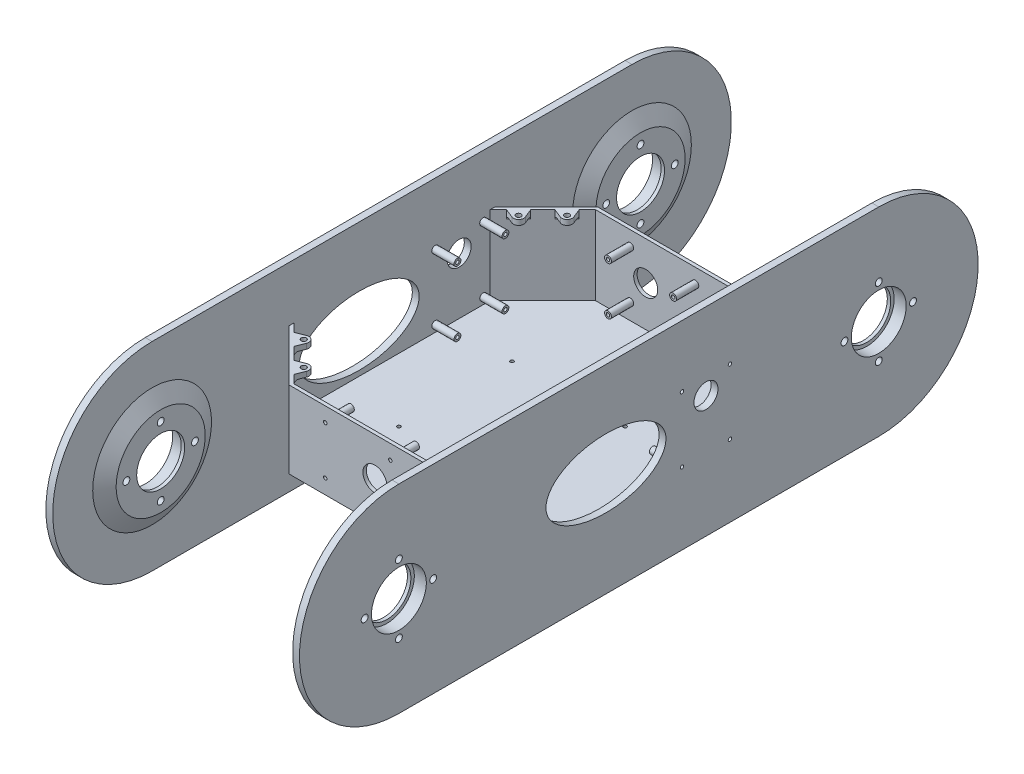
from build123d import *

# Parameters (mm, degrees)
SKETCH1_W           = 140
SKETCH1_H           = 180
BOSS_EXTRUDE1_DEPTH = 52
CHAMFER1_SIZE       = 30
BOSS_EXTRUDE2_DEPTH = 4
SKETCH3_R           = 26
BOSS_EXTRUDE3_DEPTH = 5
BOSS_EXTRUDE3_DRAFT = 60
SKETCH4_R           = 14
CUT_EXTRUDE1_DEPTH  = 2
SKETCH5_R           = 16
CUT_EXTRUDE2_DEPTH  = 256.007843017
MIRROR1_OUTLINE_W   = 16
MIRROR1_OUTLINE_H   = 4
SKETCH6_R           = 2
CUT_EXTRUDE3_DEPTH  = 257.087875543
CUT_EXTRUDE4_DEPTH  = 46
SKETCH8_R           = 1
SKETCH8_R_2         = 7
SKETCH8_RX          = 35
SKETCH8_RY          = 20
CUT_EXTRUDE5_DEPTH  = 262.082362484
CHAMFER3_SIZE       = 7
SKETCH9_R           = 1
CUT_EXTRUDE6_DEPTH  = 226.308677307
SKETCH10_R          = 1
CUT_EXTRUDE7_DEPTH  = 309.991909424
SKETCH11_R          = 2
SKETCH11_R_2        = 1
BOSS_EXTRUDE4_DEPTH = 13
SKETCH12_R          = 2
SKETCH12_R_2        = 1
BOSS_EXTRUDE5_DEPTH = 13
SKETCH13_R          = 7
CUT_EXTRUDE8_DEPTH  = 3
SKETCH14_R          = 7
CUT_EXTRUDE9_DEPTH  = 3
SKETCH15_R          = 1.5
BOSS_EXTRUDE6_DEPTH = 3
FILLET1_R           = 2


# Read off the part's stored shape, not the designer's step: Mirror1, Mirror2
with BuildPart() as part:
    # Sketch1 → Boss-Extrude1 (new body)
    with BuildSketch(Plane(origin=(0, 0, 0), x_dir=(1, 0, 0), z_dir=(0, 1, 0))):
        Rectangle(SKETCH1_W, SKETCH1_H)
    extrude(amount=BOSS_EXTRUDE1_DEPTH)

    # Chamfer1
    chamfer1_edges = [part.edges().sort_by_distance(p)[0] for p in [
        (-70, 26, 90),
        (70, 26, 90),
        (70, 26, -90),
        (-70, 26, -90),
    ]]
    chamfer(chamfer1_edges, length=CHAMFER1_SIZE)

    # Sketch2 → Boss-Extrude2 (add)
    with BuildSketch(Plane(origin=(70, 0, 0), x_dir=(0, 0, -1), z_dir=(1, 0, 0))):
        with BuildLine():
            Line((-140, 84), (140, 84))
            ThreePointArc((140, 84), (198, 26), (140, -32))
            Line((140, -32), (-140, -32))
            ThreePointArc((-140, -32), (-198, 26), (-140, 84))
        make_face()
    extrude(amount=BOSS_EXTRUDE2_DEPTH)


with BuildPart() as boss_extrude3_tool:
    # Sketch3 → Boss-Extrude3 (with draft: the straight prism first)
    with BuildSketch(Plane.ZY.offset(-65)):
        with Locations((140, 26)):
            Circle(SKETCH3_R)
    extrude(amount=-BOSS_EXTRUDE3_DEPTH)
    # Boss-Extrude3: the draft: its side faces are tilted about the plane it starts from
    boss_extrude3_sides = [boss_extrude3_tool.faces().sort_by_distance(p)[0] for p in [
        (67.5, 26, 114),
    ]]
    draft(boss_extrude3_sides, Plane.ZY.offset(-65), BOSS_EXTRUDE3_DRAFT)


with BuildPart() as part_1:
    add(part.part)

    # Boss-Extrude3: add boss_extrude3_tool
    add(boss_extrude3_tool.part)

    # Sketch4 → Cut-Extrude1 (cut)
    with BuildSketch(Plane.ZY.offset(-65)):
        with Locations((140, 26)):
            Circle(SKETCH4_R)
    extrude(amount=-CUT_EXTRUDE1_DEPTH, mode=Mode.SUBTRACT)

    # Sketch5 → Cut-Extrude2 (cut, through all)
    with BuildSketch(Plane.ZY.offset(-67)):
        with Locations((140, 26)):
            Circle(SKETCH5_R)
    extrude(amount=-CUT_EXTRUDE2_DEPTH, mode=Mode.SUBTRACT)

    # Mirror1 outline → Mirror1 (revolve, cut)
    with BuildSketch(Plane(origin=(0, 26, -140), x_dir=(0, 1, 0), z_dir=(0, 0, -1))):
        with Locations((8, 72)):
            Rectangle(MIRROR1_OUTLINE_W, MIRROR1_OUTLINE_H)
    revolve(axis=Axis((0, 26, -140), (1, 0, 0)), mode=Mode.SUBTRACT)

    # Mirror1 2 outline → Mirror1 2 (revolve)
    with BuildSketch(Plane(origin=(0, 26, -140), x_dir=(0, 1, 0), z_dir=(0, 0, -1))):
        Polygon((14, 67), (14, 65), (26, 65), (34.660254038, 70), (16, 70), (16, 67), align=None)
    revolve(axis=Axis((0, 26, -140), (1, 0, 0)))

    # Mirror2: part across plane


with BuildPart() as part_2:
    add(part_1.part)
    add(part_1.part.mirror(Plane(origin=(0, 0, 0), x_dir=(0, 0, 1), z_dir=(1, 0, 0))))

    # Sketch6 → Cut-Extrude3 (cut, symmetric)
    with BuildSketch(Plane(origin=(-65, 0, 0), x_dir=(0, 0, -1), z_dir=(1, 0, 0))):
        with Locations((-140, 46)):
            Circle(SKETCH6_R)
        with Locations((-120, 26)):
            Circle(SKETCH6_R)
        with Locations((-140, 6)):
            Circle(SKETCH6_R)
        with Locations((-160, 26)):
            Circle(SKETCH6_R)
    cut_extrude3 = extrude(amount=CUT_EXTRUDE3_DEPTH, both=True, mode=Mode.SUBTRACT)

    # Mirror3: Cut-Extrude3 across plane
    add(cut_extrude3.mirror(Plane.XY), mode=Mode.SUBTRACT)

    # Sketch7 → Cut-Extrude4 (cut)
    with BuildSketch(Plane(origin=(0, 52, 0), x_dir=(1, 0, 0), z_dir=(0, 1, 0))):
        Polygon((-70, 57.171572875), (-39.171572875, 88), (39.171572875, 88), (70, 57.171572875), (70, -57.171572875), (39.171572875, -88), (-39.171572875, -88), (-70, -57.171572875), align=None)
    extrude(amount=-CUT_EXTRUDE4_DEPTH, mode=Mode.SUBTRACT)

    # Sketch8 → Cut-Extrude5 (cut, through all)
    with BuildSketch(Plane(origin=(74, 0, 0), x_dir=(0, 0, -1), z_dir=(1, 0, 0))):
        with Locations((25.171572875, 48)):
            Circle(SKETCH8_R)
        with Locations((53.171572875, 48)):
            Circle(SKETCH8_R)
        with Locations((53.171572875, 10)):
            Circle(SKETCH8_R)
        with Locations((25.171572875, 10)):
            Circle(SKETCH8_R)
        with Locations((39.171572875, 39)):
            Circle(SKETCH8_R_2)
        with Locations(Location((-19.171572875, 29), (0, 0, -180))):
            Ellipse(SKETCH8_RX, SKETCH8_RY)
    extrude(amount=-CUT_EXTRUDE5_DEPTH, mode=Mode.SUBTRACT)

    # Chamfer3
    chamfer3_edges = [part_2.edges().sort_by_distance(p)[0] for p in [
        (0, 0, -90),
        (0, 0, 90),
        (55, 0, 75),
        (-55, 0, 75),
        (55, 0, -75),
        (-55, 0, -75),
    ]]
    chamfer(chamfer3_edges, length=CHAMFER3_SIZE)

    # Sketch9 → Cut-Extrude6 (cut, through all)
    with BuildSketch(Plane(origin=(0, 6, 0), x_dir=(1, 0, 0), z_dir=(0, 1, 0))):
        with Locations(Location((-33, 33, 0), (0, 0, 270))):
            Circle(SKETCH9_R)
        with Locations(Location((33, 33, 0), (0, 0, 270))):
            Circle(SKETCH9_R)
        with Locations(Location((33, -33, 0), (0, 0, 270))):
            Circle(SKETCH9_R)
        with Locations(Location((-33, -33, 0), (0, 0, 270))):
            Circle(SKETCH9_R)
    extrude(amount=-CUT_EXTRUDE6_DEPTH, mode=Mode.SUBTRACT)

    # Sketch10 → Cut-Extrude7 (cut, through all)
    with BuildSketch(Plane(origin=(0, 0, -90), x_dir=(-1, 0, 0), z_dir=(0, 0, -1))):
        with Locations((-19, 43.5)):
            Circle(SKETCH10_R)
        with Locations((19, 43.5)):
            Circle(SKETCH10_R)
        with Locations((19, 15.5)):
            Circle(SKETCH10_R)
        with Locations((-19, 15.5)):
            Circle(SKETCH10_R)
    extrude(amount=-CUT_EXTRUDE7_DEPTH, mode=Mode.SUBTRACT)

    # Sketch11 → Boss-Extrude4 (add)
    # profile 1 of 4: a face of its own
    with BuildSketch(Plane.ZY.offset(-70)):
        with Locations(Location((-53.171572875, 48, 0), (0, 0, 180))):
            Circle(SKETCH11_R)
        with Locations(Location((-53.171572875, 48, 0), (0, 0, 180))):
            Circle(SKETCH11_R_2, mode=Mode.SUBTRACT)
    # profile 2 of 4: a face of its own
    with BuildSketch(Plane.ZY.offset(-70)):
        with Locations(Location((-25.171572875, 48, 0), (0, 0, 180))):
            Circle(SKETCH11_R)
        with Locations(Location((-25.171572875, 48, 0), (0, 0, 180))):
            Circle(SKETCH11_R_2, mode=Mode.SUBTRACT)
    # profile 3 of 4: a face of its own
    with BuildSketch(Plane.ZY.offset(-70)):
        with Locations(Location((-25.171572875, 10, 0), (0, 0, 180))):
            Circle(SKETCH11_R)
        with Locations(Location((-25.171572875, 10, 0), (0, 0, 180))):
            Circle(SKETCH11_R_2, mode=Mode.SUBTRACT)
    # profile 4 of 4: a face of its own
    with BuildSketch(Plane.ZY.offset(-70)):
        with Locations(Location((-53.171572875, 10, 0), (0, 0, 180))):
            Circle(SKETCH11_R)
        with Locations(Location((-53.171572875, 10, 0), (0, 0, 180))):
            Circle(SKETCH11_R_2, mode=Mode.SUBTRACT)
    boss_extrude4 = extrude(amount=BOSS_EXTRUDE4_DEPTH)

    # Mirror4: Boss-Extrude4 across plane
    add(boss_extrude4.mirror(Plane(origin=(0, 0, 0), x_dir=(0, 0, 1), z_dir=(1, 0, 0))))

    # Sketch12 → Boss-Extrude5 (add)
    # profile 1 of 4: a face of its own
    with BuildSketch(Plane.XY.offset(-88)):
        with Locations(Location((-19, 43.5, 0), (0, 0, 180))):
            Circle(SKETCH12_R)
        with Locations(Location((-19, 43.5, 0), (0, 0, 180))):
            Circle(SKETCH12_R_2, mode=Mode.SUBTRACT)
    # profile 2 of 4: a face of its own
    with BuildSketch(Plane.XY.offset(-88)):
        with Locations(Location((19, 43.5, 0), (0, 0, 180))):
            Circle(SKETCH12_R)
        with Locations(Location((19, 43.5, 0), (0, 0, 180))):
            Circle(SKETCH12_R_2, mode=Mode.SUBTRACT)
    # profile 3 of 4: a face of its own
    with BuildSketch(Plane.XY.offset(-88)):
        with Locations(Location((19, 15.5, 0), (0, 0, 180))):
            Circle(SKETCH12_R)
        with Locations(Location((19, 15.5, 0), (0, 0, 180))):
            Circle(SKETCH12_R_2, mode=Mode.SUBTRACT)
    # profile 4 of 4: a face of its own
    with BuildSketch(Plane.XY.offset(-88)):
        with Locations(Location((-19, 15.5, 0), (0, 0, 180))):
            Circle(SKETCH12_R)
        with Locations(Location((-19, 15.5, 0), (0, 0, 180))):
            Circle(SKETCH12_R_2, mode=Mode.SUBTRACT)
    boss_extrude5 = extrude(amount=BOSS_EXTRUDE5_DEPTH)

    # Mirror5: Boss-Extrude5 across plane
    add(boss_extrude5.mirror(Plane.XY))

    # Sketch13 → Cut-Extrude8 (cut)
    with BuildSketch(Plane.XY.offset(90)):
        with Locations((10, 29.5)):
            Circle(SKETCH13_R)
    extrude(amount=-CUT_EXTRUDE8_DEPTH, mode=Mode.SUBTRACT)

    # Sketch14 → Cut-Extrude9 (cut)
    with BuildSketch(Plane(origin=(0, 0, -90), x_dir=(-1, 0, 0), z_dir=(0, 0, -1))):
        with Locations((10, 29.5)):
            Circle(SKETCH14_R)
    extrude(amount=-CUT_EXTRUDE9_DEPTH, mode=Mode.SUBTRACT)

    # Sketch15 → Boss-Extrude6 (add)
    # profile 1 of 8: a face of its own
    with BuildSketch(Plane(origin=(0, 52, 0), x_dir=(1, 0, 0), z_dir=(0, 1, 0))):
        with BuildLine():
            Line((-65.192388155, 61.97918472), (-59.932711253, 59.896926598))
            ThreePointArc((-59.932711253, 59.896926598), (-56.707106781, 60.564971157), (-56.039062222, 63.79057563))
            Line((-56.039062222, 63.79057563), (-58.121320344, 69.050252532))
            Line((-58.121320344, 69.050252532), (-65.192388155, 61.97918472))
        make_face()
        with Locations(Location((-58.828427125, 62.686291501, 0), (0, 0, 270))):
            Circle(SKETCH15_R, mode=Mode.SUBTRACT)
    # profile 2 of 8: a face of its own
    with BuildSketch(Plane(origin=(0, 52, 0), x_dir=(1, 0, 0), z_dir=(0, 1, 0))):
        with BuildLine():
            Line((-43.97918472, 83.192388155), (-41.896926598, 77.932711253))
            ThreePointArc((-41.896926598, 77.932711253), (-42.564971157, 74.707106781), (-45.79057563, 74.039062222))
            Line((-45.79057563, 74.039062222), (-51.050252532, 76.121320344))
            Line((-51.050252532, 76.121320344), (-43.97918472, 83.192388155))
        make_face()
        with Locations(Location((-44.686291501, 76.828427125, 0), (0, 0, 90))):
            Circle(SKETCH15_R, mode=Mode.SUBTRACT)
    # profile 3 of 8: a face of its own
    with BuildSketch(Plane(origin=(0, 52, 0), x_dir=(1, 0, 0), z_dir=(0, 1, 0))):
        with BuildLine():
            Line((51.050252532, 76.121320344), (43.97918472, 83.192388155))
            Line((43.97918472, 83.192388155), (41.896926598, 77.932711253))
            ThreePointArc((41.896926598, 77.932711253), (42.564971157, 74.707106781), (45.79057563, 74.039062222))
            Line((45.79057563, 74.039062222), (51.050252532, 76.121320344))
        make_face()
        with Locations(Location((44.686291501, 76.828427125, 0), (0, 0, 270))):
            Circle(SKETCH15_R, mode=Mode.SUBTRACT)
    # profile 4 of 8: a face of its own
    with BuildSketch(Plane(origin=(0, 52, 0), x_dir=(1, 0, 0), z_dir=(0, 1, 0))):
        with BuildLine():
            Line((65.192388155, 61.97918472), (59.932711253, 59.896926598))
            ThreePointArc((59.932711253, 59.896926598), (56.707106781, 60.564971157), (56.039062222, 63.79057563))
            Line((56.039062222, 63.79057563), (58.121320344, 69.050252532))
            Line((58.121320344, 69.050252532), (65.192388155, 61.97918472))
        make_face()
        with Locations(Location((58.828427125, 62.686291501, 0), (0, 0, 90))):
            Circle(SKETCH15_R, mode=Mode.SUBTRACT)
    # profile 5 of 8: a face of its own
    with BuildSketch(Plane(origin=(0, 52, 0), x_dir=(1, 0, 0), z_dir=(0, 1, 0))):
        with BuildLine():
            Line((65.192388155, -61.97918472), (58.121320344, -69.050252532))
            Line((58.121320344, -69.050252532), (56.039062222, -63.79057563))
            ThreePointArc((56.039062222, -63.79057563), (56.707106781, -60.564971157), (59.932711253, -59.896926598))
            Line((59.932711253, -59.896926598), (65.192388155, -61.97918472))
        make_face()
        with Locations(Location((58.828427125, -62.686291501, 0), (0, 0, 270))):
            Circle(SKETCH15_R, mode=Mode.SUBTRACT)
    # profile 6 of 8: a face of its own
    with BuildSketch(Plane(origin=(0, 52, 0), x_dir=(1, 0, 0), z_dir=(0, 1, 0))):
        with BuildLine():
            Line((51.050252532, -76.121320344), (45.79057563, -74.039062222))
            ThreePointArc((45.79057563, -74.039062222), (42.564971157, -74.707106781), (41.896926598, -77.932711253))
            Line((41.896926598, -77.932711253), (43.97918472, -83.192388155))
            Line((43.97918472, -83.192388155), (51.050252532, -76.121320344))
        make_face()
        with Locations(Location((44.686291501, -76.828427125, 0), (0, 0, 90))):
            Circle(SKETCH15_R, mode=Mode.SUBTRACT)
    # profile 7 of 8: a face of its own
    with BuildSketch(Plane(origin=(0, 52, 0), x_dir=(1, 0, 0), z_dir=(0, 1, 0))):
        with BuildLine():
            Line((-51.050252532, -76.121320344), (-43.97918472, -83.192388155))
            Line((-43.97918472, -83.192388155), (-41.896926598, -77.932711253))
            ThreePointArc((-41.896926598, -77.932711253), (-42.564971157, -74.707106781), (-45.79057563, -74.039062222))
            Line((-45.79057563, -74.039062222), (-51.050252532, -76.121320344))
        make_face()
        with Locations(Location((-44.686291501, -76.828427125, 0), (0, 0, 270))):
            Circle(SKETCH15_R, mode=Mode.SUBTRACT)
    # profile 8 of 8: a face of its own
    with BuildSketch(Plane(origin=(0, 52, 0), x_dir=(1, 0, 0), z_dir=(0, 1, 0))):
        with BuildLine():
            Line((-65.192388155, -61.97918472), (-59.932711253, -59.896926598))
            ThreePointArc((-59.932711253, -59.896926598), (-56.707106781, -60.564971157), (-56.039062222, -63.79057563))
            Line((-56.039062222, -63.79057563), (-58.121320344, -69.050252532))
            Line((-58.121320344, -69.050252532), (-65.192388155, -61.97918472))
        make_face()
        with Locations(Location((-58.828427125, -62.686291501, 0), (0, 0, 90))):
            Circle(SKETCH15_R, mode=Mode.SUBTRACT)
    extrude(amount=-BOSS_EXTRUDE6_DEPTH)

    # Fillet1
    fillet1_edges = [part_2.edges().sort_by_distance(p)[0] for p in [
        (-47.514718626, 49, -79.656854249),
        (-61.656854249, 49, -65.514718626),
        (47.514718626, 49, -79.656854249),
        (61.656854249, 49, -65.514718626),
        (61.656854249, 49, 65.514718626),
        (47.514718626, 49, 79.656854249),
        (-47.514718626, 49, 79.656854249),
        (-61.656854249, 49, 65.514718626),
    ]]
    fillet(fillet1_edges, radius=FILLET1_R)


solid = part_2.part
